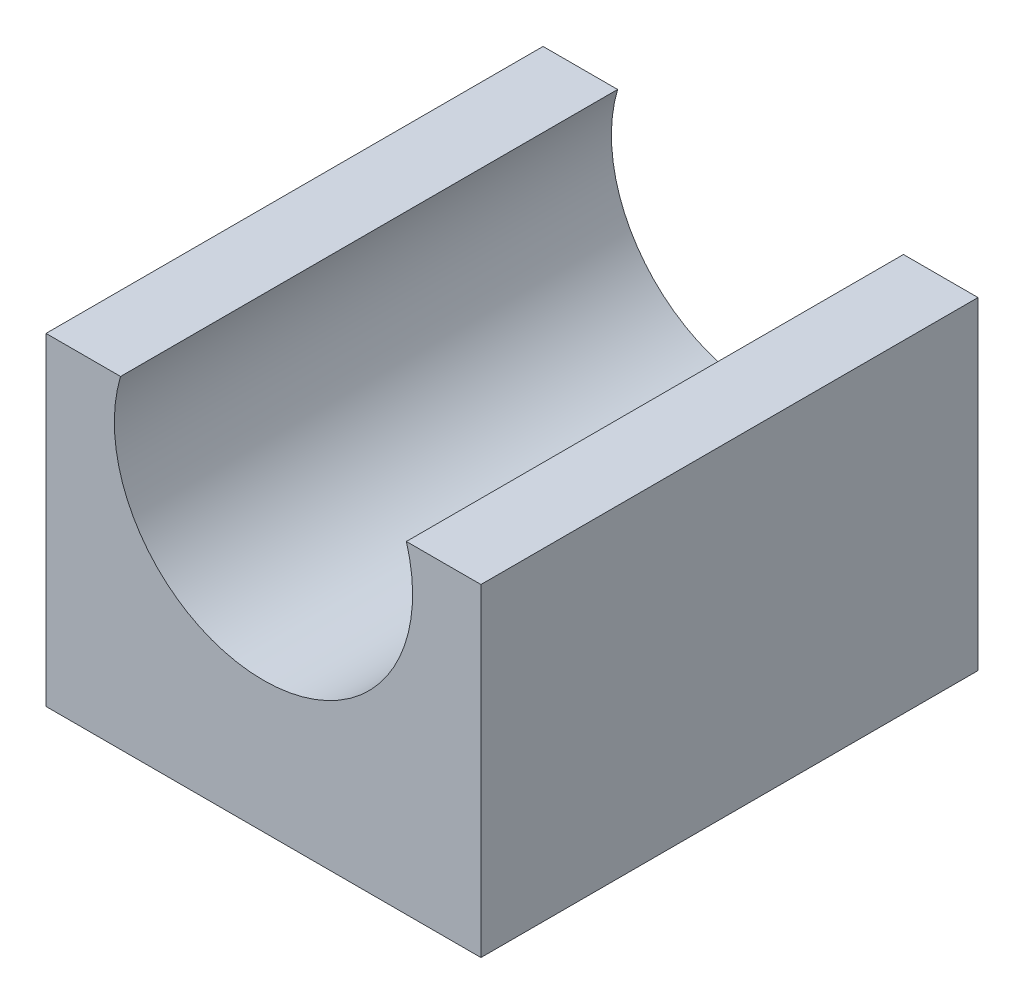
from build123d import *

# Parameters (mm, degrees)
BOSS_EXTRUDE1_DEPTH = 20


with BuildPart() as part:
    # Sketch1 → Boss-Extrude1 (new body)
    with BuildSketch(Plane.XY):
        with BuildLine():
            Line((-5.75, 6.5), (-8.75, 6.5))
            Line((-8.75, 6.5), (-8.75, -6.5))
            Line((-8.75, -6.5), (8.75, -6.5))
            Line((8.75, -6.5), (8.75, 6.5))
            Line((8.75, 6.5), (5.75, 6.5))
            ThreePointArc((5.75, 6.5), (0, -1.21391365), (-5.75, 6.5))
        make_face()
    extrude(amount=BOSS_EXTRUDE1_DEPTH)


solid = part.part
